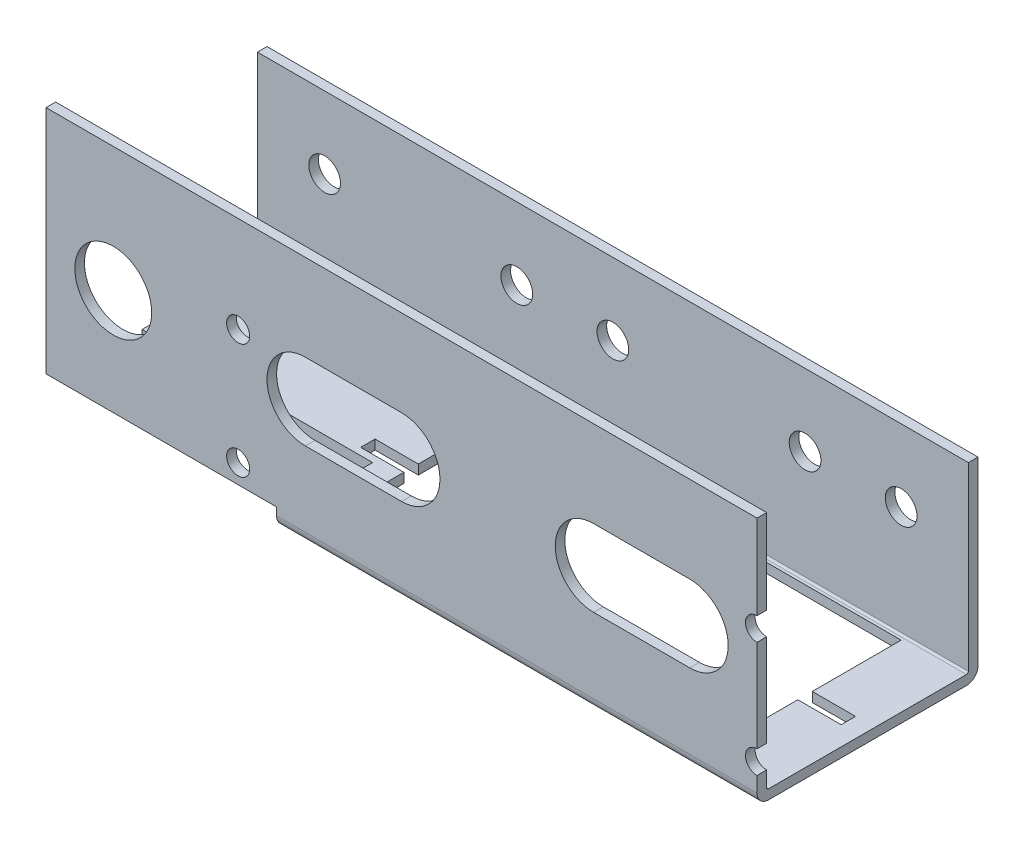
from build123d import *

# Parameters (mm, degrees)
FESTPLATTENBLECH_SCHNITT_LINEAR_START        = -14.177516002
FESTPLATTENBLECH_SCHNITT_LINEAR_AU_2_W       = 115
FESTPLATTENBLECH_SCHNITT_LINEAR_AU_2_H       = 1
FESTPLATTENBLECH_SCHNITT_LINEAR_AUSTRA_DEPTH = 20.6
FESTPLATTENBLECH_SCHNITT_LINEAR_START_2      = 6.622483998
FESTPLATTENBLECH_SCHNITT_LINEAR_AU_3_O_W     = 115
FESTPLATTENBLECH_SCHNITT_LINEAR_AU_3_O_H     = 6
FESTPLATTENBLECH_SCHNITT_LINEAR_AU_3_DEPTH   = 1
FESTPLATTENBLECH_SCHNITT_LINEAR_START_3      = -15.377516002
FESTPLATTENBLECH_SCHNITT_LINEAR_AU_4_O_R     = 4
FESTPLATTENBLECH_SCHNITT_LINEAR_AU_4_O_R_2   = 1.65
FESTPLATTENBLECH_SCHNITT_LINEAR_AU_4_O_R_3   = 1.2
FESTPLATTENBLECH_SCHNITT_LINEAR_AU_4_DEPTH   = 1
FESTPLATTENBLECH_SCHNITT_LINEAR_START_4      = -59.8
FESTPLATTENBLECH_SCHNITT_LINEAR_AU_5_O_W     = 3
FESTPLATTENBLECH_SCHNITT_LINEAR_AU_5_O_H     = 1
FESTPLATTENBLECH_SCHNITT_LINEAR_AU_5_DEPTH   = 115
FESTPLATTENBLECH_SCHNITT_LINEAR_AU_6_O_W     = 8
FESTPLATTENBLECH_SCHNITT_LINEAR_AU_6_O_H     = 1
FESTPLATTENBLECH_SCHNITT_LINEAR_AU_6_DEPTH   = 37.5
FESTPLATTENBLECH_SCHNITT_LINEAR_START_5      = 17.7
FESTPLATTENBLECH_SCHNITT_LINEAR_AU_7_O_W     = 8
FESTPLATTENBLECH_SCHNITT_LINEAR_AU_7_O_H     = 1
FESTPLATTENBLECH_SCHNITT_LINEAR_AU_7_DEPTH   = 37.5
FESTPLATTENBLECH_SCHNITT_LINEAR_START_6      = -12.3
FESTPLATTENBLECH_SCHNITT_LINEAR_AU_8_O_W     = 8
FESTPLATTENBLECH_SCHNITT_LINEAR_AU_8_O_H     = 1
FESTPLATTENBLECH_SCHNITT_LINEAR_AU_8_DEPTH   = 20
FESTPLATTENBLECH_SCHNITT_LINEAR_AU_9_O_R     = 4
FESTPLATTENBLECH_SCHNITT_LINEAR_AU_9_O_R_2   = 1.2
FESTPLATTENBLECH_SCHNITT_LINEAR_AU_9_DEPTH   = 1
FESTPLATTENBLECH_SCHNITT_LINEAR_START_7      = -16
FESTPLATTENBLECH_SCHNITT_LINEAR_AU_11_R      = 1.65
FESTPLATTENBLECH_SCHNITT_LINEAR_AU_10_DEPTH  = 22.622483998
SKIZZE1_W                                    = 41
SKIZZE1_H                                    = 20
SCHNITT_LINEAR_AUSTRAGEN1_DEPTH              = 65.144368423
SKIZZE2_W                                    = 50
SKIZZE2_H                                    = 1.5
SCHNITT_LINEAR_AUSTRAGEN2_DEPTH              = 65.144368423
SKIZZE3_OUTSIDE_W                            = 141.024
SKIZZE3_OUTSIDE_H                            = 49.024
SKIZZE3_OUTSIDE_W_2                          = 74
SKIZZE3_OUTSIDE_H_2                          = 23
SCHNITT_LINEAR_AUSTRAGEN3_DEPTH              = 65.144368423
SKIZZE9_W                                    = 24
SKIZZE9_H                                    = 10
SCHNITT_LINEAR_AUSTRAGEN5_DEPTH              = 2


with BuildPart() as part:
    # <Festplattenblech>-<Schnitt-Linear austragen2>: read off the stored shape, not the designer's step
    # Festplattenblech_-_Schnitt-Linear au 2 → <Festplattenblech>-<Schnitt-Linear austragen2> (new body)
    with BuildSketch(Plane.XY.offset(FESTPLATTENBLECH_SCHNITT_LINEAR_START)):
        with Locations((-2.3, 1.027254306)):
            Rectangle(FESTPLATTENBLECH_SCHNITT_LINEAR_AU_2_W, FESTPLATTENBLECH_SCHNITT_LINEAR_AU_2_H)
    extrude(amount=FESTPLATTENBLECH_SCHNITT_LINEAR_AUSTRA_DEPTH)



with BuildPart() as body_2:
    # Festplattenblech_-_Schnitt-Linear au 3 o → Festplattenblech_-_Schnitt-Linear au 3 (new body)
    with BuildSketch(Plane.XY.offset(FESTPLATTENBLECH_SCHNITT_LINEAR_START_2)):
        with Locations((-2.3, 23.527254306)):
            Rectangle(FESTPLATTENBLECH_SCHNITT_LINEAR_AU_3_O_W, FESTPLATTENBLECH_SCHNITT_LINEAR_AU_3_O_H)
    extrude(amount=FESTPLATTENBLECH_SCHNITT_LINEAR_AU_3_DEPTH)


with BuildPart() as body_3:
    # Festplattenblech_-_Schnitt-Linear au 4 o → Festplattenblech_-_Schnitt-Linear au 4 (new body)
    # profile 1 of 12: a face of its own
    with BuildSketch(Plane.XY.offset(FESTPLATTENBLECH_SCHNITT_LINEAR_START_3)):
        with Locations((-42.3, 13.527254306)):
            Circle(FESTPLATTENBLECH_SCHNITT_LINEAR_AU_4_O_R)
        with Locations((-42.3, 13.027254306)):
            Circle(FESTPLATTENBLECH_SCHNITT_LINEAR_AU_4_O_R_2, mode=Mode.SUBTRACT)
    # profile 2 of 12: a face of its own
    with BuildSketch(Plane.XY.offset(FESTPLATTENBLECH_SCHNITT_LINEAR_START_3)):
        with BuildLine():
            ThreePointArc((-22.3, 17.527254306), (-26.3, 13.527254306), (-22.3, 9.527254306))
            Line((-22.3, 9.527254306), (-12.3, 9.527254306))
            ThreePointArc((-12.3, 9.527254306), (-8.3, 13.527254306), (-12.3, 17.527254306))
            Line((-12.3, 17.527254306), (-22.3, 17.527254306))
        make_face()
        with Locations((-22.3, 13.027254306)):
            Circle(FESTPLATTENBLECH_SCHNITT_LINEAR_AU_4_O_R_2, mode=Mode.SUBTRACT)
        with Locations((-12.3, 13.027254306)):
            Circle(FESTPLATTENBLECH_SCHNITT_LINEAR_AU_4_O_R_2, mode=Mode.SUBTRACT)
    # profile 3 of 12: a face of its own
    with BuildSketch(Plane.XY.offset(FESTPLATTENBLECH_SCHNITT_LINEAR_START_3)):
        with Locations((-55.3, 16.527254306)):
            Circle(FESTPLATTENBLECH_SCHNITT_LINEAR_AU_4_O_R_3)
    # profile 4 of 12: a face of its own
    with BuildSketch(Plane.XY.offset(FESTPLATTENBLECH_SCHNITT_LINEAR_START_3)):
        with Locations((-55.3, 4.527254306)):
            Circle(FESTPLATTENBLECH_SCHNITT_LINEAR_AU_4_O_R_3)
    # profile 5 of 12: a face of its own
    with BuildSketch(Plane.XY.offset(FESTPLATTENBLECH_SCHNITT_LINEAR_START_3)):
        with Locations((-29.3, 16.527254306)):
            Circle(FESTPLATTENBLECH_SCHNITT_LINEAR_AU_4_O_R_3)
    # profile 6 of 12: a face of its own
    with BuildSketch(Plane.XY.offset(FESTPLATTENBLECH_SCHNITT_LINEAR_START_3)):
        with Locations((-29.3, 4.527254306)):
            Circle(FESTPLATTENBLECH_SCHNITT_LINEAR_AU_4_O_R_3)
    # profile 7 of 12: a face of its own
    with BuildSketch(Plane.XY.offset(FESTPLATTENBLECH_SCHNITT_LINEAR_START_3)):
        with Locations((50.7, 4.527254306)):
            Circle(FESTPLATTENBLECH_SCHNITT_LINEAR_AU_4_O_R_3)
    # profile 8 of 12: a face of its own
    with BuildSketch(Plane.XY.offset(FESTPLATTENBLECH_SCHNITT_LINEAR_START_3)):
        with BuildLine():
            ThreePointArc((17.7, 9.527254306), (21.7, 13.527254306), (17.7, 17.527254306))
            Line((17.7, 17.527254306), (7.7, 17.527254306))
            ThreePointArc((7.7, 17.527254306), (3.7, 13.527254306), (7.7, 9.527254306))
            Line((7.7, 9.527254306), (17.7, 9.527254306))
        make_face()
        with Locations((7.7, 13.027254306)):
            Circle(FESTPLATTENBLECH_SCHNITT_LINEAR_AU_4_O_R_2, mode=Mode.SUBTRACT)
        with Locations((17.7, 13.027254306)):
            Circle(FESTPLATTENBLECH_SCHNITT_LINEAR_AU_4_O_R_2, mode=Mode.SUBTRACT)
    # profile 9 of 12: a face of its own
    with BuildSketch(Plane.XY.offset(FESTPLATTENBLECH_SCHNITT_LINEAR_START_3)):
        with Locations((24.7, 4.527254306)):
            Circle(FESTPLATTENBLECH_SCHNITT_LINEAR_AU_4_O_R_3)
    # profile 10 of 12: a face of its own
    with BuildSketch(Plane.XY.offset(FESTPLATTENBLECH_SCHNITT_LINEAR_START_3)):
        with Locations((24.7, 16.527254306)):
            Circle(FESTPLATTENBLECH_SCHNITT_LINEAR_AU_4_O_R_3)
    # profile 11 of 12: a face of its own
    with BuildSketch(Plane.XY.offset(FESTPLATTENBLECH_SCHNITT_LINEAR_START_3)):
        with Locations((37.7, 13.527254306)):
            Circle(FESTPLATTENBLECH_SCHNITT_LINEAR_AU_4_O_R)
        with Locations((37.7, 13.027254306)):
            Circle(FESTPLATTENBLECH_SCHNITT_LINEAR_AU_4_O_R_2, mode=Mode.SUBTRACT)
    # profile 12 of 12: a face of its own
    with BuildSketch(Plane.XY.offset(FESTPLATTENBLECH_SCHNITT_LINEAR_START_3)):
        with Locations((50.7, 16.527254306)):
            Circle(FESTPLATTENBLECH_SCHNITT_LINEAR_AU_4_O_R_3)
    extrude(amount=FESTPLATTENBLECH_SCHNITT_LINEAR_AU_4_DEPTH)


with BuildPart() as part_1:
    add(part.part)

    add(body_2.part)  # Festplattenblech_-_Schnitt-Linear au 5 merges body 2

    add(body_3.part)  # Festplattenblech_-_Schnitt-Linear au 5 merges body 3
    # Festplattenblech_-_Schnitt-Linear au 5 o → Festplattenblech_-_Schnitt-Linear au 5 (add)
    with BuildSketch(Plane.YZ.offset(FESTPLATTENBLECH_SCHNITT_LINEAR_START_4)):
        with Locations((19.027254306, -14.877516002)):
            Rectangle(FESTPLATTENBLECH_SCHNITT_LINEAR_AU_5_O_W, FESTPLATTENBLECH_SCHNITT_LINEAR_AU_5_O_H)
        with BuildLine():
            Line((1.727254306, -15.377516002), (9.527254306, -15.377516002))
            Line((9.527254306, -15.377516002), (9.527254306, -14.377516002))
            Line((9.527254306, -14.377516002), (1.727254306, -14.377516002))
            ThreePointArc((1.727254306, -14.377516002), (1.58583295, -14.318937358), (1.527254306, -14.177516002))
            Line((1.527254306, -14.177516002), (0.527254306, -14.177516002))
            ThreePointArc((0.527254306, -14.177516002), (0.878726169, -15.026044139), (1.727254306, -15.377516002))
        make_face()
        with BuildLine():
            Line((0.527254306, 6.422483998), (1.527254306, 6.422483998))
            ThreePointArc((1.527254306, 6.422483998), (1.58583295, 6.563905354), (1.727254306, 6.622483998))
            Line((1.727254306, 6.622483998), (9.527254306, 6.622483998))
            Line((9.527254306, 6.622483998), (9.527254306, 7.622483998))
            Line((9.527254306, 7.622483998), (1.727254306, 7.622483998))
            ThreePointArc((1.727254306, 7.622483998), (0.878726169, 7.271012135), (0.527254306, 6.422483998))
        make_face()
        with Locations((19.027254306, 7.122483998)):
            Rectangle(FESTPLATTENBLECH_SCHNITT_LINEAR_AU_5_O_W, FESTPLATTENBLECH_SCHNITT_LINEAR_AU_5_O_H)
    extrude(amount=FESTPLATTENBLECH_SCHNITT_LINEAR_AU_5_DEPTH)

    # Festplattenblech_-_Schnitt-Linear au 6 o → Festplattenblech_-_Schnitt-Linear au 6 (add)
    with BuildSketch(Plane.YZ.offset(FESTPLATTENBLECH_SCHNITT_LINEAR_START_4)):
        with Locations((13.527254306, -14.877516002)):
            Rectangle(FESTPLATTENBLECH_SCHNITT_LINEAR_AU_6_O_W, FESTPLATTENBLECH_SCHNITT_LINEAR_AU_6_O_H)
        with Locations((13.527254306, 7.122483998)):
            Rectangle(FESTPLATTENBLECH_SCHNITT_LINEAR_AU_6_O_W, FESTPLATTENBLECH_SCHNITT_LINEAR_AU_6_O_H)
    extrude(amount=FESTPLATTENBLECH_SCHNITT_LINEAR_AU_6_DEPTH)

    # Festplattenblech_-_Schnitt-Linear au 7 o → Festplattenblech_-_Schnitt-Linear au 7 (add)
    with BuildSketch(Plane.YZ.offset(FESTPLATTENBLECH_SCHNITT_LINEAR_START_5)):
        with Locations((13.527254306, -14.877516002)):
            Rectangle(FESTPLATTENBLECH_SCHNITT_LINEAR_AU_7_O_W, FESTPLATTENBLECH_SCHNITT_LINEAR_AU_7_O_H)
        with Locations((13.527254306, 7.122483998)):
            Rectangle(FESTPLATTENBLECH_SCHNITT_LINEAR_AU_7_O_W, FESTPLATTENBLECH_SCHNITT_LINEAR_AU_7_O_H)
    extrude(amount=FESTPLATTENBLECH_SCHNITT_LINEAR_AU_7_DEPTH)

    # Festplattenblech_-_Schnitt-Linear au 8 o → Festplattenblech_-_Schnitt-Linear au 8 (add)
    with BuildSketch(Plane.YZ.offset(FESTPLATTENBLECH_SCHNITT_LINEAR_START_6)):
        with Locations((13.527254306, -14.877516002)):
            Rectangle(FESTPLATTENBLECH_SCHNITT_LINEAR_AU_8_O_W, FESTPLATTENBLECH_SCHNITT_LINEAR_AU_8_O_H)
        with Locations((13.527254306, 7.122483998)):
            Rectangle(FESTPLATTENBLECH_SCHNITT_LINEAR_AU_8_O_W, FESTPLATTENBLECH_SCHNITT_LINEAR_AU_8_O_H)
    extrude(amount=FESTPLATTENBLECH_SCHNITT_LINEAR_AU_8_DEPTH)

    # Festplattenblech_-_Schnitt-Linear au 9 o → Festplattenblech_-_Schnitt-Linear au 9 (cut)
    with BuildSketch(Plane.XY.offset(FESTPLATTENBLECH_SCHNITT_LINEAR_START_2)):
        with Locations((-42.3, 13.527254306)):
            Circle(FESTPLATTENBLECH_SCHNITT_LINEAR_AU_9_O_R)
        with BuildLine():
            ThreePointArc((-12.3, 9.527254306), (-8.3, 13.527254306), (-12.3, 17.527254306))
            Line((-12.3, 17.527254306), (-12.3, 9.527254306))
        make_face()
        with BuildLine():
            ThreePointArc((-22.3, 17.527254306), (-26.3, 13.527254306), (-22.3, 9.527254306))
            Line((-22.3, 9.527254306), (-22.3, 17.527254306))
        make_face()
        with Locations((-55.3, 16.527254306)):
            Circle(FESTPLATTENBLECH_SCHNITT_LINEAR_AU_9_O_R_2)
        with Locations((-55.3, 4.527254306)):
            Circle(FESTPLATTENBLECH_SCHNITT_LINEAR_AU_9_O_R_2)
        with Locations((-29.3, 16.527254306)):
            Circle(FESTPLATTENBLECH_SCHNITT_LINEAR_AU_9_O_R_2)
        with Locations((-29.3, 4.527254306)):
            Circle(FESTPLATTENBLECH_SCHNITT_LINEAR_AU_9_O_R_2)
        with Locations((50.7, 4.527254306)):
            Circle(FESTPLATTENBLECH_SCHNITT_LINEAR_AU_9_O_R_2)
        with BuildLine():
            ThreePointArc((7.7, 17.527254306), (3.7, 13.527254306), (7.7, 9.527254306))
            Line((7.7, 9.527254306), (7.7, 17.527254306))
        make_face()
        with BuildLine():
            ThreePointArc((17.7, 9.527254306), (21.7, 13.527254306), (17.7, 17.527254306))
            Line((17.7, 17.527254306), (17.7, 9.527254306))
        make_face()
        with Locations((24.7, 4.527254306)):
            Circle(FESTPLATTENBLECH_SCHNITT_LINEAR_AU_9_O_R_2)
        with Locations((24.7, 16.527254306)):
            Circle(FESTPLATTENBLECH_SCHNITT_LINEAR_AU_9_O_R_2)
        with Locations((37.7, 13.527254306)):
            Circle(FESTPLATTENBLECH_SCHNITT_LINEAR_AU_9_O_R)
        with Locations((50.7, 16.527254306)):
            Circle(FESTPLATTENBLECH_SCHNITT_LINEAR_AU_9_O_R_2)
    extrude(amount=FESTPLATTENBLECH_SCHNITT_LINEAR_AU_9_DEPTH, mode=Mode.SUBTRACT)

    # Festplattenblech_-_Schnitt-Linear au 11 → Festplattenblech_-_Schnitt-Linear au 10 (cut)
    with BuildSketch(Plane.XY.offset(FESTPLATTENBLECH_SCHNITT_LINEAR_START_7)):
        with BuildLine():
            Line((-12.3, 14.677254306), (-12.3, 11.377254306))
            ThreePointArc((-12.3, 11.377254306), (-10.65, 13.027254306), (-12.3, 14.677254306))
        make_face()
        with BuildLine():
            Line((-22.3, 11.377254306), (-22.3, 14.677254306))
            ThreePointArc((-22.3, 14.677254306), (-23.95, 13.027254306), (-22.3, 11.377254306))
        make_face()
        with BuildLine():
            Line((7.7, 11.377254306), (7.7, 14.677254306))
            ThreePointArc((7.7, 14.677254306), (6.05, 13.027254306), (7.7, 11.377254306))
        make_face()
        with BuildLine():
            Line((17.7, 14.677254306), (17.7, 11.377254306))
            ThreePointArc((17.7, 11.377254306), (19.35, 13.027254306), (17.7, 14.677254306))
        make_face()
        with Locations((37.7, 13.027254306)):
            Circle(FESTPLATTENBLECH_SCHNITT_LINEAR_AU_11_R)
        with Locations((-42.3, 13.027254306)):
            Circle(FESTPLATTENBLECH_SCHNITT_LINEAR_AU_11_R)
    extrude(amount=FESTPLATTENBLECH_SCHNITT_LINEAR_AU_10_DEPTH, mode=Mode.SUBTRACT)


with BuildPart() as part_2:
    # Festplattenblech: read off the stored shape, not the designer's step
    # Festplattenblech: moved
    add(part_1.part.moved(Location((2.3, -1.5272543, 3.877516))))

    # Skizze1 → Schnitt-Linear austragen1 (cut, through all)
    with BuildSketch(Plane.XZ.offset(1)):
        Rectangle(SKIZZE1_W, SKIZZE1_H)
    extrude(amount=-SCHNITT_LINEAR_AUSTRAGEN1_DEPTH, mode=Mode.SUBTRACT)

    # Skizze2 → Schnitt-Linear austragen2 (cut, through all)
    with BuildSketch(Plane.XZ.offset(1)):
        Rectangle(SKIZZE2_W, SKIZZE2_H)
    extrude(amount=-SCHNITT_LINEAR_AUSTRAGEN2_DEPTH, mode=Mode.SUBTRACT)

    # Skizze3 outside → Schnitt-Linear austragen3 (cut, through all)
    with BuildSketch(Plane.XZ.offset(1)):
        Rectangle(SKIZZE3_OUTSIDE_W, SKIZZE3_OUTSIDE_H)
        with Locations((-10, 0)):
            Rectangle(SKIZZE3_OUTSIDE_W_2, SKIZZE3_OUTSIDE_H_2, mode=Mode.SUBTRACT)
    extrude(amount=-SCHNITT_LINEAR_AUSTRAGEN3_DEPTH, mode=Mode.SUBTRACT)

    # Skizze9 → Schnitt-Linear austragen5 (cut)
    with BuildSketch(Plane.XZ.offset(1)):
        with Locations((-35, 6.5)):
            Rectangle(SKIZZE9_W, SKIZZE9_H)
    extrude(amount=-SCHNITT_LINEAR_AUSTRAGEN5_DEPTH, mode=Mode.SUBTRACT)


solid = part_2.part
